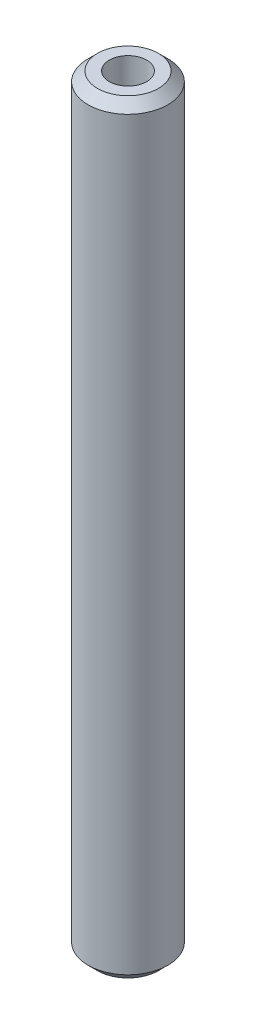
from build123d import *

# Parameters (mm, degrees)
SKETCH1_R           = 20
BOSS_EXTRUDE1_DEPTH = 383.081654478
SKETCH2_R           = 9.372682349
CUT_EXTRUDE1_DEPTH  = 385.124399118
CHAMFER1_SIZE       = 4.72842305


with BuildPart() as part:
    # Sketch1 → Boss-Extrude1 (new body)
    with BuildSketch(Plane(origin=(0, 0, 0), x_dir=(1, 0, 0), z_dir=(0, 1, 0))):
        Circle(SKETCH1_R)
    extrude(amount=BOSS_EXTRUDE1_DEPTH)

    # Sketch2 → Cut-Extrude1 (cut, through all)
    with BuildSketch(Plane(origin=(0, 0, 0), x_dir=(1, 0, 0), z_dir=(0, 1, 0))):
        Circle(SKETCH2_R)
    extrude(amount=CUT_EXTRUDE1_DEPTH, mode=Mode.SUBTRACT)

    # Chamfer1
    chamfer1_edges = [part.edges().sort_by_distance(p)[0] for p in [
        (-20, 383.081654478, 0),
        (-20, 0, 0),
    ]]
    chamfer(chamfer1_edges, length=CHAMFER1_SIZE)


solid = part.part
